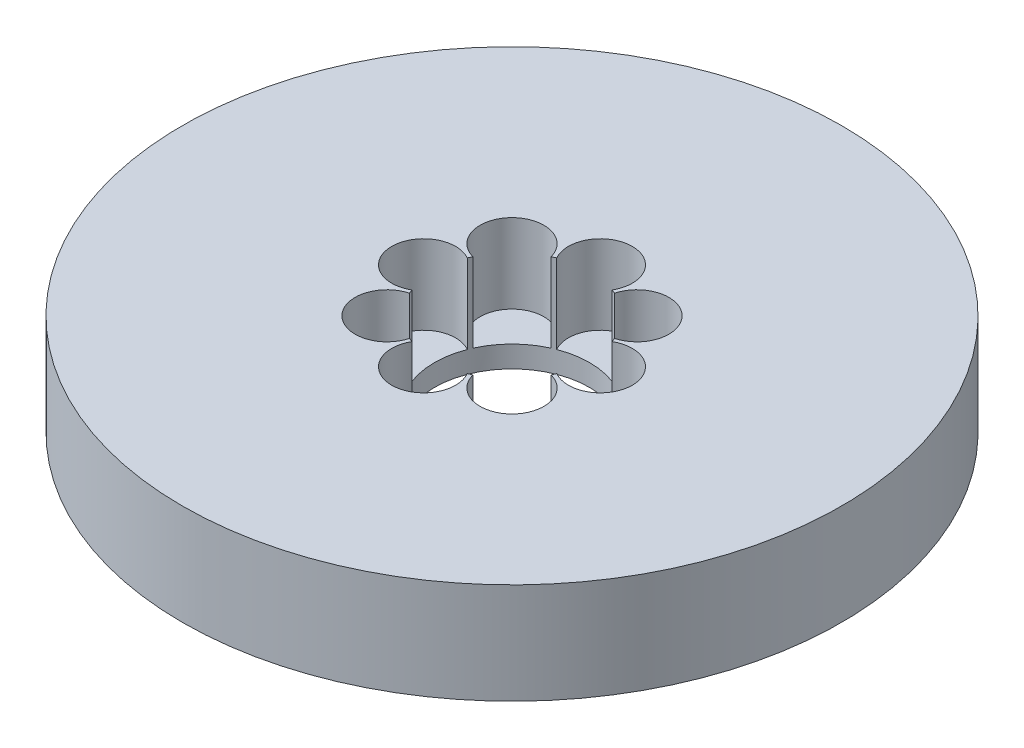
from build123d import *

# Parameters (mm, degrees)
SKETCH1_R           = 42.5
BOSS_EXTRUDE1_DEPTH = 13
SKETCH2_R           = 10
CUT_EXTRUDE1_DEPTH  = 62.493902137
SKETCH3_R           = 4.119951321
CUT_EXTRUDE2_DEPTH  = 10.219273731
CIRPATTERN1_COUNT   = 8


with BuildPart() as part:
    # Sketch1 → Boss-Extrude1 (new body)
    with BuildSketch(Plane(origin=(0, 0, 0), x_dir=(1, 0, 0), z_dir=(0, 1, 0))):
        Circle(SKETCH1_R)
    extrude(amount=BOSS_EXTRUDE1_DEPTH)

    # Sketch2 → Cut-Extrude1 (cut, through all)
    with BuildSketch(Plane(origin=(0, 0, 0), x_dir=(1, 0, 0), z_dir=(0, 1, 0))):
        Circle(SKETCH2_R)
    extrude(amount=CUT_EXTRUDE1_DEPTH, mode=Mode.SUBTRACT)

    # Sketch3 → Cut-Extrude2 (cut)
    with BuildSketch(Plane(origin=(0, 13, 0), x_dir=(1, 0, 0), z_dir=(0, 1, 0))):
        with Locations((-11.392464932, 0)):
            Circle(SKETCH3_R)
    cut_extrude2 = extrude(amount=-CUT_EXTRUDE2_DEPTH, mode=Mode.SUBTRACT)

    # CirPattern1: Cut-Extrude2 ×8 about axis
    cirpattern1_axis = Axis((0, 0, 0), (0, 1, 0))
    for i in range(1, CIRPATTERN1_COUNT):
        add(cut_extrude2.rotate(cirpattern1_axis, i * 360 / CIRPATTERN1_COUNT), mode=Mode.SUBTRACT)


solid = part.part
